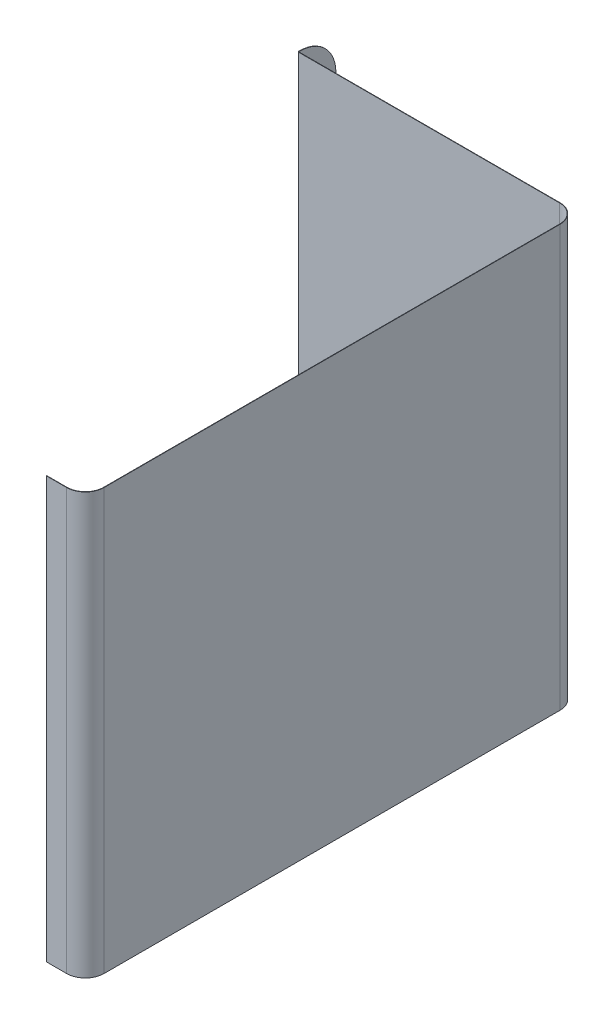
from build123d import *

# Parameters (mm, degrees)
BASE_FLANGE1_DEPTH = 871.6
CUT_EXTRUDE1_DEPTH = 10


# Sheet-metal steps are written as plain solids
with BuildPart() as part:
    # Sketch1 → Base-Flange1 (new body)
    with BuildSketch(Plane(origin=(0, 0, 0), x_dir=(1, 0, 0), z_dir=(0, 1, 0))):
        with BuildLine():
            Line((-231, 460), (-231, 383.6))
            ThreePointArc((-231, 383.6), (-230.53137085, 382.46862915), (-229.4, 382))
            Line((-229.4, 382), (311, 382))
            ThreePointArc((311, 382), (337.870057685, 370.870057685), (349, 344))
            Line((349, 344), (349, -600))
            ThreePointArc((349, -600), (337.870057685, -626.870057685), (311, -638))
            Line((311, -638), (269, -638))
            Line((269, -638), (269, -638.8))
            Line((269, -638.8), (311, -638.8))
            ThreePointArc((311, -638.8), (338.43574311, -627.43574311), (349.8, -600))
            Line((349.8, -600), (349.8, 344))
            ThreePointArc((349.8, 344), (338.43574311, 371.43574311), (311, 382.8))
            Line((311, 382.8), (-229.4, 382.8))
            ThreePointArc((-229.4, 382.8), (-229.965685425, 383.034314575), (-230.2, 383.6))
            Line((-230.2, 383.6), (-230.2, 460))
            Line((-230.2, 460), (-231, 460))
        make_face()
    extrude(amount=BASE_FLANGE1_DEPTH)

    # Sketch4 → Cut-Extrude1 (cut)
    with BuildSketch(Plane(origin=(-230.2, 0, 0), x_dir=(0, 0, -1), z_dir=(1, 0, 0))):
        with BuildLine():
            Line((460, 871.6), (385, 871.6))
            ThreePointArc((385, 871.6), (438.033008589, 849.633008589), (460, 796.6))
            Line((460, 796.6), (460, 871.6))
        make_face()
        with BuildLine():
            Line((460, 0), (385, 0))
            ThreePointArc((385, 0), (438.033008589, 21.966991411), (460, 75))
            Line((460, 75), (460, 0))
        make_face()
    extrude(amount=-CUT_EXTRUDE1_DEPTH, mode=Mode.SUBTRACT)


solid = part.part
